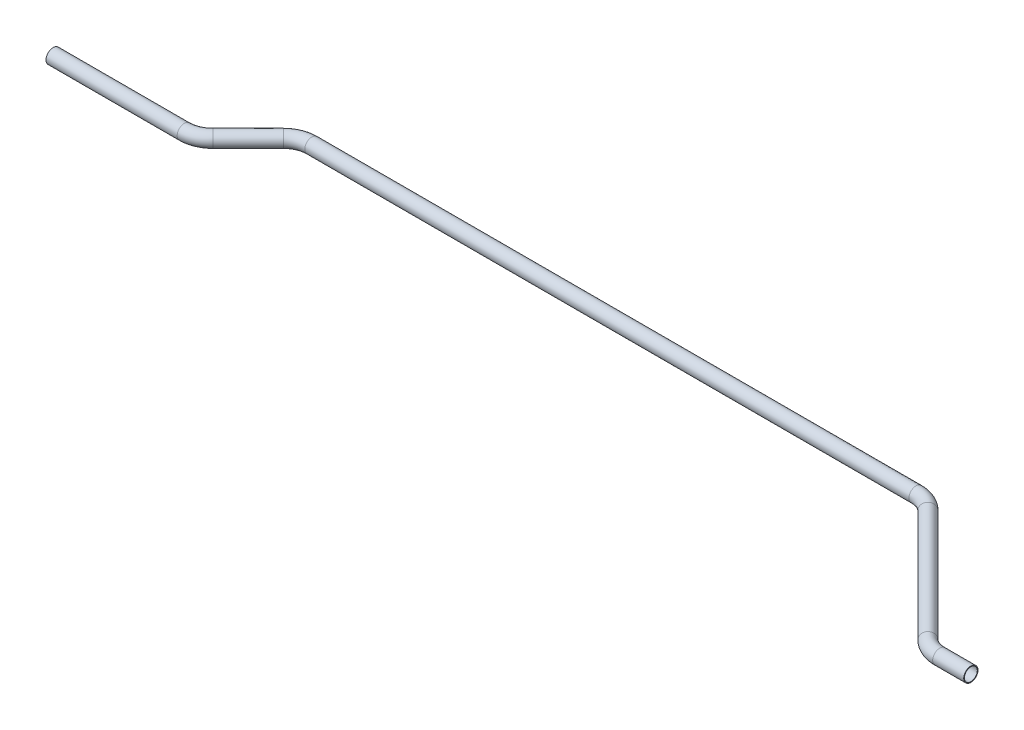
from build123d import *

# Parameters (mm, degrees)
SKETCH2_R   = 6.35
SKETCH2_R_2 = 5.715


with BuildPart() as part:
    # Sweep1: sweep along a path in Sketch1
    with BuildLine(Plane(origin=(0, 0, 0), x_dir=(1, 0, 0), z_dir=(0, 1, 0))) as sweep1_path:
        Line((0, 0), (116.478975516, 0))
        ThreePointArc((116.478975516, 0), (126.199134698, 1.933459874), (134.439487758, 7.439487758))
        Line((134.439487758, 7.439487758), (165.704371034, 38.704371034))
        ThreePointArc((165.704371034, 38.704371034), (173.944724094, 44.210398917), (183.664883276, 46.143858792))
        Line((183.664883276, 46.143858792), (720.155374307, 46.143858792))
        ThreePointArc((720.155374307, 46.143858792), (729.875533489, 44.210398917), (738.115886549, 38.704371034))
        Line((738.115886549, 38.704371034), (837.536911034, -60.716653451))
        ThreePointArc((837.536911034, -60.716653451), (845.777264094, -66.222681334), (855.497423276, -68.156141208))
        Line((855.497423276, -68.156141208), (883.076398792, -68.156141208))
    # Sketch2 → Sweep1 (sweep)
    with BuildSketch(Plane(origin=(0, 0, 0), x_dir=(0, 0, -1), z_dir=(1, 0, 0))):
        Circle(SKETCH2_R)
        Circle(SKETCH2_R_2, mode=Mode.SUBTRACT)
    sweep(path=sweep1_path.line)


solid = part.part
